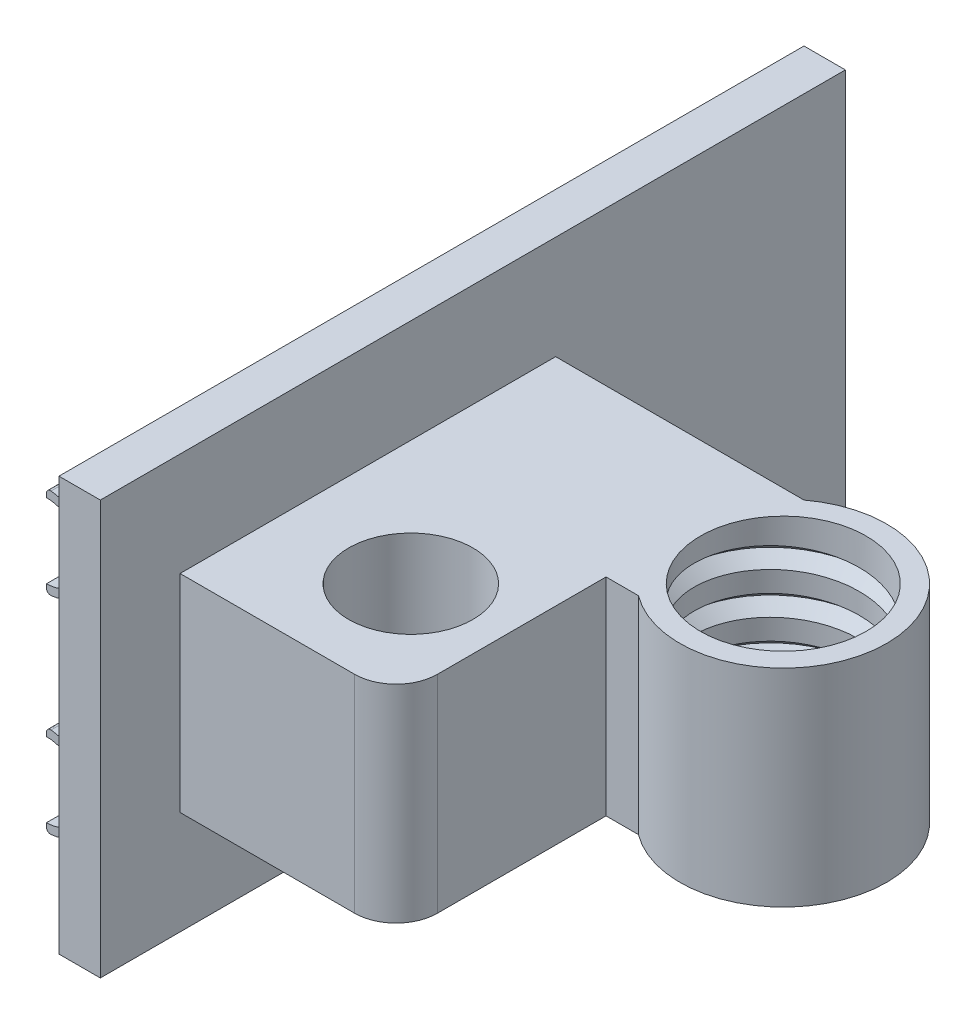
from build123d import *

# Parameters (mm, degrees)
SKETCH1_R           = 20
BOSS_EXTRUDE1_DEPTH = 50
SKETCH2_W           = 180
SKETCH2_H           = 100
BOSS_EXTRUDE2_DEPTH = 10
CUT_SWEEP2_PITCH    = 10
BOSS_EXTRUDE3_START = -10
BOSS_EXTRUDE3_DEPTH = 10
SKETCH15_W          = 47.164851966
SKETCH15_H          = 50.736323616
BOSS_EXTRUDE4_DEPTH = 50
SKETCH16_R          = 15
CUT_EXTRUDE1_DEPTH  = 67
SKETCH18_W          = 5.010553362
SKETCH18_H          = 50.736323616
BOSS_EXTRUDE5_DEPTH = 50
FILLET1_R           = 10
FILLET2_R           = 1


with BuildPart() as part:
    # Sketch1 → Boss-Extrude1 (new body)
    with BuildSketch(Plane(origin=(0, 0, 0), x_dir=(1, 0, 0), z_dir=(0, 1, 0))):
        with BuildLine():
            Line((-75, 20), (-75, -20))
            Line((-75, -20), (-15, -20))
            ThreePointArc((-15, -20), (25, 0), (-15, 20))
            Line((-15, 20), (-75, 20))
        make_face()
        with Locations(Location((0, 0, 0), (0, 0, 270))):
            Circle(SKETCH1_R, mode=Mode.SUBTRACT)
    extrude(amount=BOSS_EXTRUDE1_DEPTH)

    # Sketch2 → Boss-Extrude2 (add)
    with BuildSketch(Plane.ZY.offset(75)):
        with Locations((0, 25)):
            Rectangle(SKETCH2_W, SKETCH2_H)
    extrude(amount=BOSS_EXTRUDE2_DEPTH)

    # Cut-Sweep2: the profile of Sketch11 profile screwed along a right-hand helix of 7.25 turns, 16 arcs to a turn; built about Z, then put on its axis
    cut_sweep2_z = Axis((0, 0, 0), (0, 0, 1))
    cut_sweep2_corners = [(-14.141923492, 14.141923492, 9.999753854), (-14.141923492, 14.141923492, 15.000246146), (-16.296666596, 16.296666596, 12.5)]
    with BuildLine(mode=Mode.PRIVATE) as cut_sweep2_profile:
        Line(cut_sweep2_corners[0], cut_sweep2_corners[1])
        Line(cut_sweep2_corners[1], cut_sweep2_corners[2])
        Line(cut_sweep2_corners[2], cut_sweep2_corners[0])
    cut_sweep2_cap = Face(cut_sweep2_profile.wire())
    cut_sweep2_turn_angles = [0, 11.25, 22.5, 33.75, 45, 56.25, 67.5, 78.75, 90, 101.25, 112.5, 123.75, 135, 146.25, 157.5, 168.75, 180, 191.25, 202.5, 213.75, 225, 236.25, 247.5, 258.75, 270, 281.25, 292.5, 303.75, 315, 326.25, 337.5, 348.75, 360]
    cut_sweep2_turn_weights = [1, 0.9807852804032304, 1, 0.9807852804032304, 1, 0.9807852804032304, 1, 0.9807852804032304, 1, 0.9807852804032304, 1, 0.9807852804032304, 1, 0.9807852804032304, 1, 0.9807852804032304, 1, 0.9807852804032304, 1, 0.9807852804032304, 1, 0.9807852804032304, 1, 0.9807852804032304, 1, 0.9807852804032304, 1, 0.9807852804032304, 1, 0.9807852804032304, 1, 0.9807852804032304, 1]
    cut_sweep2_turn_rails = [Edge.make_bspline([Vector(p[0], p[1], 0).rotate(cut_sweep2_z, cut_sweep2_turn_angles[k]) / cut_sweep2_turn_weights[k] + Vector(0, 0, p[2] + CUT_SWEEP2_PITCH * cut_sweep2_turn_angles[k] / 360) for k in range(33)], [0, 0, 0, 1, 1, 2, 2, 3, 3, 4, 4, 5, 5, 6, 6, 7, 7, 8, 8, 9, 9, 10, 10, 11, 11, 12, 12, 13, 13, 14, 14, 15, 15, 16, 16, 16], 2, cut_sweep2_turn_weights) for p in cut_sweep2_corners]
    cut_sweep2_turn_sides = [Face.make_surface_from_curves(cut_sweep2_turn_rails[p[0]], cut_sweep2_turn_rails[p[1]]) for p in [(0, 1), (1, 2), (2, 0)]]
    cut_sweep2_last_angles = [2520, 2531.25, 2542.5, 2553.75, 2565, 2576.25, 2587.5, 2598.75, 2610]
    cut_sweep2_last_weights = [1, 0.9807852804032304, 1, 0.9807852804032304, 1, 0.9807852804032304, 1, 0.9807852804032405, 1]
    cut_sweep2_last_rails = [Edge.make_bspline([Vector(p[0], p[1], 0).rotate(cut_sweep2_z, cut_sweep2_last_angles[k]) / cut_sweep2_last_weights[k] + Vector(0, 0, p[2] + CUT_SWEEP2_PITCH * cut_sweep2_last_angles[k] / 360) for k in range(9)], [0, 0, 0, 1, 1, 2, 2, 3, 3, 4, 4, 4], 2, cut_sweep2_last_weights) for p in cut_sweep2_corners]
    cut_sweep2_last_sides = [Face.make_surface_from_curves(cut_sweep2_last_rails[p[0]], cut_sweep2_last_rails[p[1]]) for p in [(0, 1), (1, 2), (2, 0)]]
    cut_sweep2 = Plane(origin=(0, 60, 0), x_dir=(-0.7071067811865537, 0, -0.7071067811865414), z_dir=(0, -1, 0)) * Solid(Shell([*[p.moved(Location((0, 0, CUT_SWEEP2_PITCH * i))) for i in range(7) for p in cut_sweep2_turn_sides], *cut_sweep2_last_sides, cut_sweep2_cap, cut_sweep2_cap.rotate(cut_sweep2_z, 2610).moved(Location((0, 0, CUT_SWEEP2_PITCH * 2610 / 360)))]))
    add(cut_sweep2, mode=Mode.SUBTRACT)

    # Sketch14 → Boss-Extrude3 (add)
    with BuildSketch(Plane.XY.offset(90).offset(BOSS_EXTRUDE3_START)):
        with BuildLine():
            Line((-85, 55.481684785), (-88.463169713, 55.481684785))
            ThreePointArc((-88.463169713, 55.481684785), (-92.490850004, 59.520990827), (-98, 61))
            Line((-98, 61), (-98, 59))
            ThreePointArc((-98, 59), (-94.021002832, 58.072644024), (-90.861993842, 55.481684785))
            ThreePointArc((-90.861993842, 55.481684785), (-89, 50), (-90.861993842, 44.518315215))
            ThreePointArc((-90.861993842, 44.518315215), (-94.021002832, 41.927355976), (-98, 41))
            Line((-98, 41), (-98, 39))
            ThreePointArc((-98, 39), (-92.490850004, 40.479009173), (-88.463169713, 44.518315215))
            Line((-88.463169713, 44.518315215), (-85, 44.518315215))
            Line((-85, 44.518315215), (-85, 55.481684785))
        make_face()
        with BuildLine():
            Line((-85, 5.481684785), (-85, -5.481684785))
            Line((-85, -5.481684785), (-88.463169713, -5.481684785))
            ThreePointArc((-88.463169713, -5.481684785), (-92.490850004, -9.520990827), (-98, -11))
            Line((-98, -11), (-98, -9))
            ThreePointArc((-98, -9), (-94.021002832, -8.072644024), (-90.861993842, -5.481684785))
            ThreePointArc((-90.861993842, -5.481684785), (-89, 0), (-90.861993842, 5.481684785))
            ThreePointArc((-90.861993842, 5.481684785), (-94.021002832, 8.072644024), (-98, 9))
            Line((-98, 9), (-98, 11))
            ThreePointArc((-98, 11), (-92.490850004, 9.520990827), (-88.463169713, 5.481684785))
            Line((-88.463169713, 5.481684785), (-85, 5.481684785))
        make_face()
    boss_extrude3 = extrude(amount=-BOSS_EXTRUDE3_DEPTH)

    # Mirror1: Boss-Extrude3 across plane
    add(boss_extrude3.mirror(Plane.XY))

    # Sketch15 → Boss-Extrude4 (add)
    with BuildSketch(Plane(origin=(0, 50, 0), x_dir=(1, 0, 0), z_dir=(0, 1, 0))):
        with Locations((-51.417574017, -45.368161808)):
            Rectangle(SKETCH15_W, SKETCH15_H)
    extrude(amount=-BOSS_EXTRUDE4_DEPTH)

    # Sketch16 → Cut-Extrude1 (cut)
    with BuildSketch(Plane(origin=(0, 50, 0), x_dir=(1, 0, 0), z_dir=(0, 1, 0))):
        with Locations(Location((-44.995148034, -44.996323616, 0), (0, 0, 270))):
            Circle(SKETCH16_R)
    extrude(amount=-CUT_EXTRUDE1_DEPTH, mode=Mode.SUBTRACT)

    # Sketch18 → Boss-Extrude5 (add)
    with BuildSketch(Plane(origin=(0, 50, 0), x_dir=(1, 0, 0), z_dir=(0, 1, 0))):
        with Locations((-25.329871353, -45.368161808)):
            Rectangle(SKETCH18_W, SKETCH18_H)
    extrude(amount=-BOSS_EXTRUDE5_DEPTH)

    # Fillet1
    fillet1_edges = [part.edges().sort_by_distance(p)[0] for p in [
        (-22.824594672, 25, 70.736323616),
    ]]
    fillet(fillet1_edges, radius=FILLET1_R)

    # Fillet2
    fillet2_edges = [part.edges().sort_by_distance(p)[0] for p in [
        (-98, 61, -75),
        (-98, 39, -75),
        (-98, -11, -75),
        (-98, 11, -75),
        (-98, 39, 75),
        (-98, 61, 75),
        (-98, -11, 75),
        (-98, 11, 75),
    ]]
    fillet(fillet2_edges, radius=FILLET2_R)


solid = part.part
